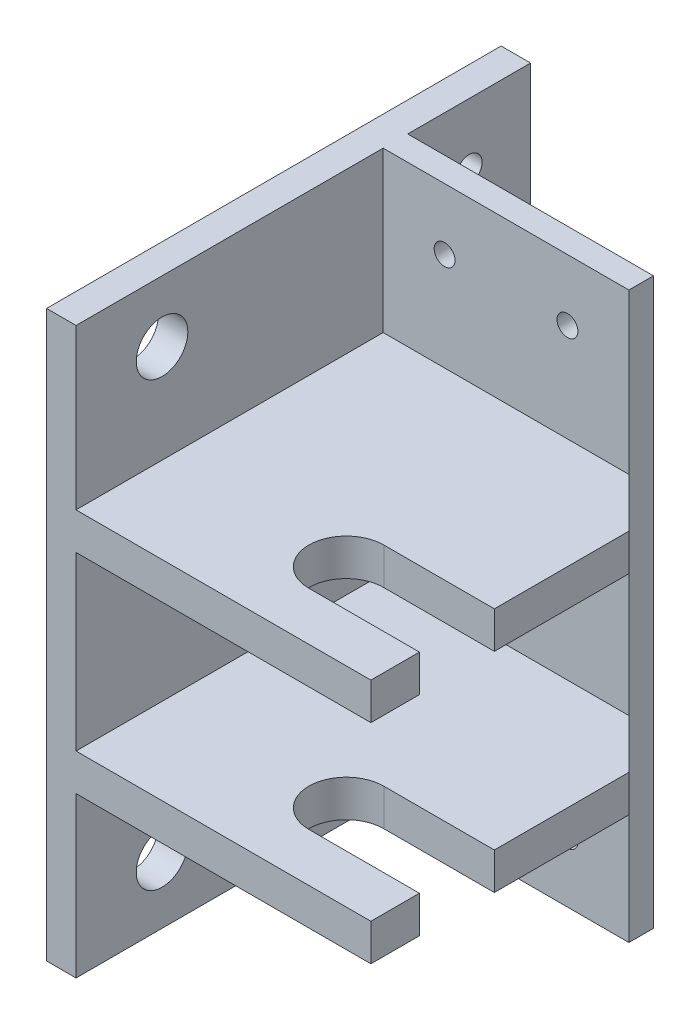
from build123d import *

# Parameters (mm, degrees)
SKETCH_1_W              = 100
SKETCH_1_H              = 230
EXTRUDE_1_DEPTH         = 10
EXTRUDE_2_DEPTH         = 135
EXTRUDE_2_DEPTH_BACK    = 50
SKETCH_1_3_W            = 12
SKETCH_1_3_H            = 230
SKETCH_2_W              = 125
SKETCH_2_H              = 15
EXTRUDE_3_DEPTH         = 120
CUT_EXTRUDE_1_DEPTH     = 245.642596455
CHAMFER_2_SIZE          = 20
HOLE_WIZARD_3_D         = 21
HOLE_WIZARD_3_DEPTH     = 100
HOLE_WIZARD_M10_1_D     = 8.5
HOLE_WIZARD_M10_1_DEPTH = 24.5
HOLE_WIZARD_M10_1_TIP   = 2.553657631
HOLE_WIZARD_2_D         = 10.5
HOLE_WIZARD_2_DEPTH     = 100


with BuildPart() as part:
    # 草图1 → 凸台-拉伸1 (new body)
    with BuildSketch(Plane.XY):
        with Locations((50, 0)):
            Rectangle(SKETCH_1_W, SKETCH_1_H)
    extrude(amount=EXTRUDE_1_DEPTH)

    # 草图1<3> → 凸台-拉伸2 (add, two sides: drawn at the far end of the back side and taken through both)
    with BuildSketch(Plane.XY.offset(-EXTRUDE_2_DEPTH_BACK)):
        with Locations((-6, 0)):
            Rectangle(SKETCH_1_3_W, SKETCH_1_3_H)
    extrude(amount=EXTRUDE_2_DEPTH + EXTRUDE_2_DEPTH_BACK)

    # 草图2 → 凸台-拉伸3 (add)
    with BuildSketch(Plane(origin=(0, 0, 0), x_dir=(0, 0, -1), z_dir=(1, 0, 0))):
        with Locations((-72.5, -42.5)):
            Rectangle(SKETCH_2_W, SKETCH_2_H)
        with Locations((-72.5, 42.5)):
            Rectangle(SKETCH_2_W, SKETCH_2_H)
    extrude(amount=EXTRUDE_3_DEPTH)

    # 草图3 → 切除-拉伸1 (cut, through all)
    with BuildSketch(Plane(origin=(0, 50, 0), x_dir=(1, 0, 0), z_dir=(0, 1, 0))):
        with BuildLine():
            Line((120, -115.25), (75, -115.25))
            ThreePointArc((75, -115.25), (59.75, -100), (75, -84.75))
            Line((75, -84.75), (120, -84.75))
            ThreePointArc((120, -84.75), (135.25, -100), (120, -115.25))
        make_face()
    extrude(amount=-CUT_EXTRUDE_1_DEPTH, mode=Mode.SUBTRACT)

    # 倒角2
    chamfer_2_edges = [part.edges().sort_by_distance(p)[0] for p in [
        (120, 42.5, 10),
        (120, -42.5, 10),
    ]]
    chamfer(chamfer_2_edges, length=CHAMFER_2_SIZE - 0.0001)  # a hair under: the kernel refuses the full size

    # 孔3
    with Locations(Plane(origin=(0, 0, 0), x_dir=(0, 0, -1), z_dir=(1, 0, 0))):
        with Locations((-100, -90), (-100, 90)):
            Hole(HOLE_WIZARD_3_D / 2, depth=HOLE_WIZARD_3_DEPTH)

    # M10 螺纹孔1
    with Locations(Plane.XY.offset(10)):
        with Locations((25, -90), (75, -90), (75, 90), (25, 90), (75, 0), (25, 0)):
            Hole(HOLE_WIZARD_M10_1_D / 2, depth=HOLE_WIZARD_M10_1_DEPTH)
            with Locations((0, 0, -(HOLE_WIZARD_M10_1_DEPTH + HOLE_WIZARD_M10_1_TIP / 2))):  # 118° drill point
                Cone(0, HOLE_WIZARD_M10_1_D / 2, HOLE_WIZARD_M10_1_TIP, mode=Mode.SUBTRACT)

    # 孔2
    with Locations(Plane.ZY.offset(12)):
        with Locations((-25, 90), (-25, -90), (-25, 0)):
            Hole(HOLE_WIZARD_2_D / 2, depth=HOLE_WIZARD_2_DEPTH)


solid = part.part
